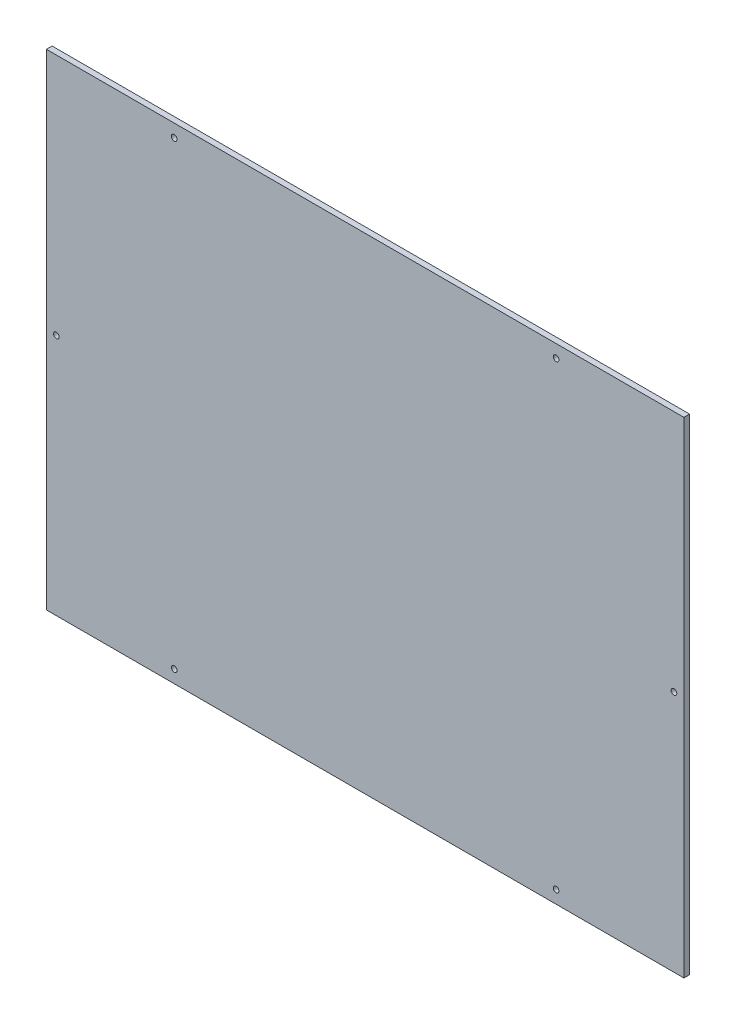
from build123d import *

# Parameters (mm, degrees)
SCHIZZO1_W                   = 449
SCHIZZO1_H                   = 342
SCHIZZO1_R                   = 2
ESTRUSIONE_ESTRUSIONE1_DEPTH = 4


with BuildPart() as part:
    # Schizzo1 → Estrusione-Estrusione1 (new body)
    with BuildSketch(Plane.XY):
        with Locations((-224.5, 171)):
            Rectangle(SCHIZZO1_W, SCHIZZO1_H)
        with Locations((-90, 333)):
            Circle(SCHIZZO1_R, mode=Mode.SUBTRACT)
        with Locations((-7, 171)):
            Circle(SCHIZZO1_R, mode=Mode.SUBTRACT)
        with Locations((-359, 333)):
            Circle(SCHIZZO1_R, mode=Mode.SUBTRACT)
        with Locations((-442, 171)):
            Circle(SCHIZZO1_R, mode=Mode.SUBTRACT)
        with Locations((-359, 9)):
            Circle(SCHIZZO1_R, mode=Mode.SUBTRACT)
        with Locations((-90, 9)):
            Circle(SCHIZZO1_R, mode=Mode.SUBTRACT)
    extrude(amount=ESTRUSIONE_ESTRUSIONE1_DEPTH)


solid = part.part
